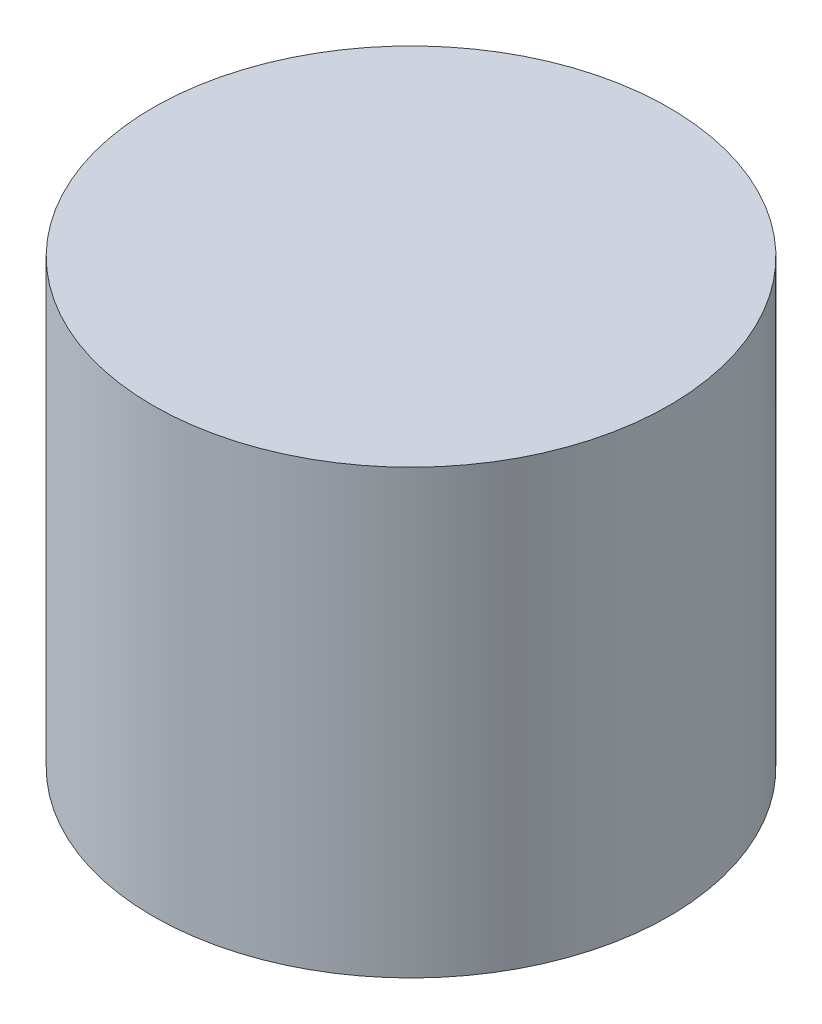
from build123d import *

# Parameters (mm, degrees)
SKETCH1_R           = 17.5
BOSS_EXTRUDE1_DEPTH = 30
SKETCH2_W           = 22.36
SKETCH2_H           = 22
CUT_EXTRUDE1_DEPTH  = 30


with BuildPart() as part:
    # Sketch1 → Boss-Extrude1 (new body)
    with BuildSketch(Plane(origin=(0, 0, 0), x_dir=(1, 0, 0), z_dir=(0, 1, 0))):
        Circle(SKETCH1_R)
    extrude(amount=BOSS_EXTRUDE1_DEPTH)

    # Sketch2 → Cut-Extrude1 (cut)
    with BuildSketch(Plane(origin=(0, 0, 0), x_dir=(0, 0, -1), z_dir=(1, 0, 0))):
        with Locations((0, 15)):
            Rectangle(SKETCH2_W, SKETCH2_H)
    extrude(amount=-CUT_EXTRUDE1_DEPTH, mode=Mode.SUBTRACT)


solid = part.part
